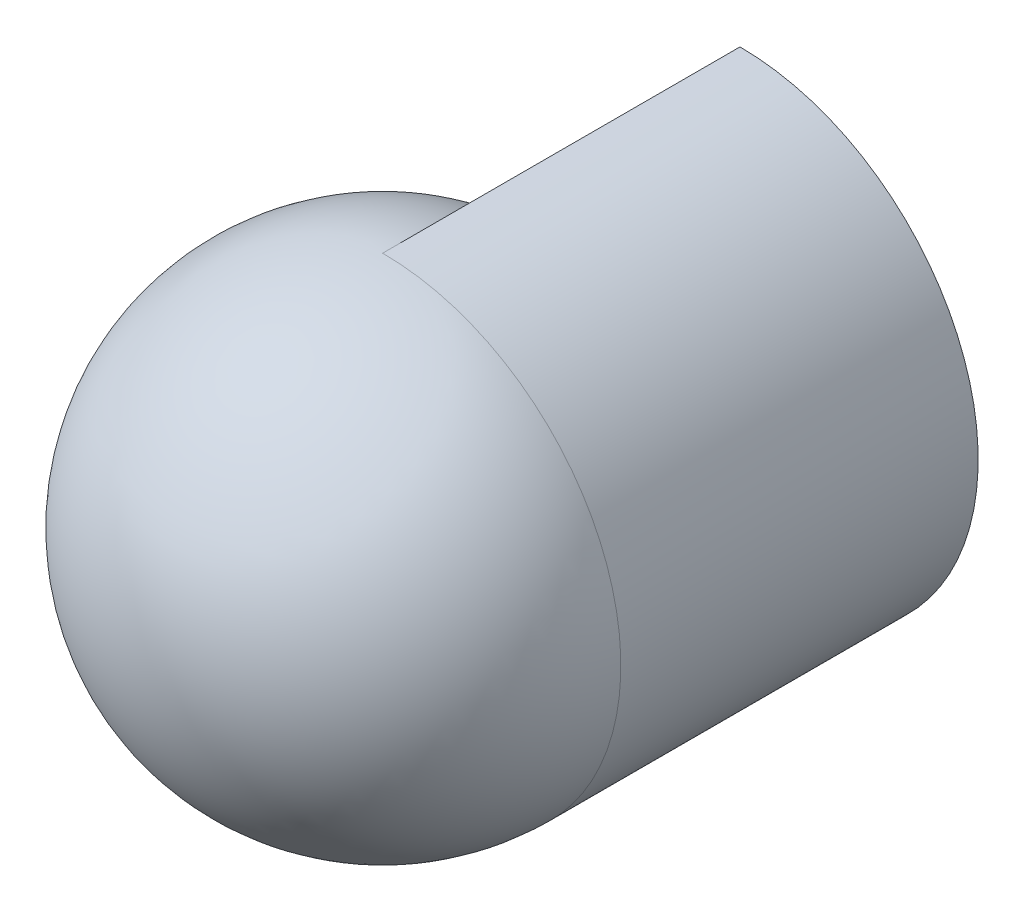
from build123d import *

# Parameters (mm, degrees)
CUT_EXTRUDE3_DEPTH = 762
SWEEP1_START       = -76.2
SWEEP1_DEPTH       = 76.2


# Read off the part's stored shape, not the designer's step: Sweep1
with BuildPart() as part:
    # Sketch2 → Revolve3 (revolve)
    with BuildSketch(Plane.XY):
        with BuildLine():
            Line((0, 50.8), (0, -50.8))
            ThreePointArc((0, -50.8), (50.8, 0), (0, 50.8))
        make_face()
    revolve(axis=Axis((0, 50.8, 0), (0, -1, 0)))

    # Sketch2<4> → Cut-Extrude3 (cut)
    with BuildSketch(Plane.XY):
        with BuildLine():
            Line((0, 50.8), (0, -50.8))
            ThreePointArc((0, -50.8), (50.8, 0), (0, 50.8))
        make_face()
    extrude(amount=-CUT_EXTRUDE3_DEPTH, mode=Mode.SUBTRACT)

    # Sweep1 outline → Sweep1 (add)
    with BuildSketch(Plane.XY.offset(SWEEP1_START)):
        with BuildLine():
            ThreePointArc((0, -50.8), (50.8, 0), (0, 50.8))
            Line((0, 50.8), (0, -50.8))
        make_face()
    extrude(amount=SWEEP1_DEPTH)


solid = part.part
